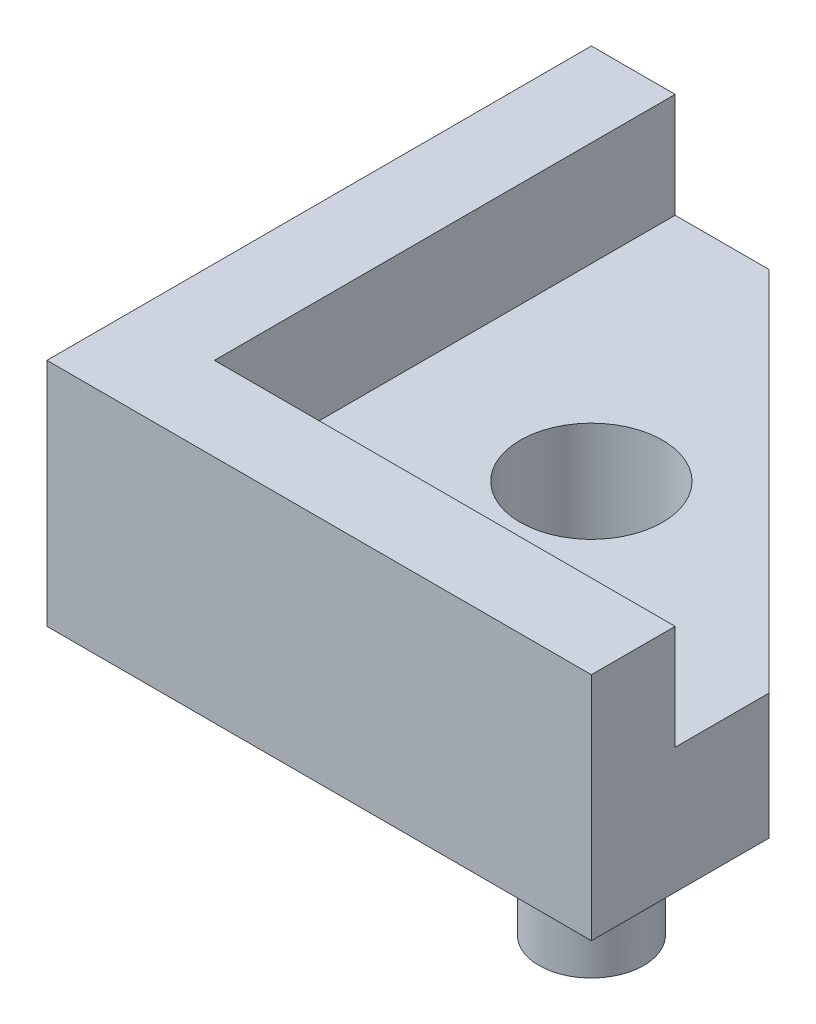
from build123d import *

# Parameters (mm, degrees)
BOSS_EXTRUDE2_DEPTH = 3
SKETCH4_R           = 1.25
BOSS_EXTRUDE3_DEPTH = 2.5
BOSS_EXTRUDE4_DEPTH = 2.5
CUT_EXTRUDE1_REACH  = 17.835
SKETCH6_R           = 1.7


with BuildPart() as part:
    # Sketch3 → Boss-Extrude2 (new body)
    with BuildSketch(Plane(origin=(0, 0, 0), x_dir=(1, 0, 0), z_dir=(0, 1, 0))):
        Polygon((-2.5, 10.5), (-2.5, -2.5), (10.5, -2.5), (10.5, 1.742640687), (1.742640687, 10.5), align=None)
    extrude(amount=-BOSS_EXTRUDE2_DEPTH)

    # Sketch4 → Boss-Extrude3 (add)
    with BuildSketch(Plane.XZ.offset(3)):
        with Locations((7.889087297, -0.110912703)):
            Circle(SKETCH4_R)
        with Locations((0.110912703, -7.889087297)):
            Circle(SKETCH4_R)
    extrude(amount=BOSS_EXTRUDE3_DEPTH)

    # Sketch5 → Boss-Extrude4 (add)
    with BuildSketch(Plane(origin=(0, 0, 0), x_dir=(1, 0, 0), z_dir=(0, 1, 0))):
        Polygon((-2.5, 10.5), (-2.5, -2.5), (10.5, -2.5), (10.5, -0.5), (-0.5, -0.5), (-0.5, 10.5), align=None)
    extrude(amount=BOSS_EXTRUDE4_DEPTH)

    # Sketch6 → Cut-Extrude1 (cut, up to next)
    with BuildSketch(Plane(origin=(0, 0, 0), x_dir=(1, 0, 0), z_dir=(0, 1, 0)), mode=Mode.PRIVATE) as cut_extrude1_sk1:
        with Locations((4, 4)):
            Circle(SKETCH6_R)
    cut_extrude1_tool1 = extrude(cut_extrude1_sk1.sketch, amount=-CUT_EXTRUDE1_REACH, mode=Mode.PRIVATE) & part.part
    add(cut_extrude1_tool1.solids().sort_by_distance((4, 0, -4))[0], mode=Mode.SUBTRACT)


solid = part.part
